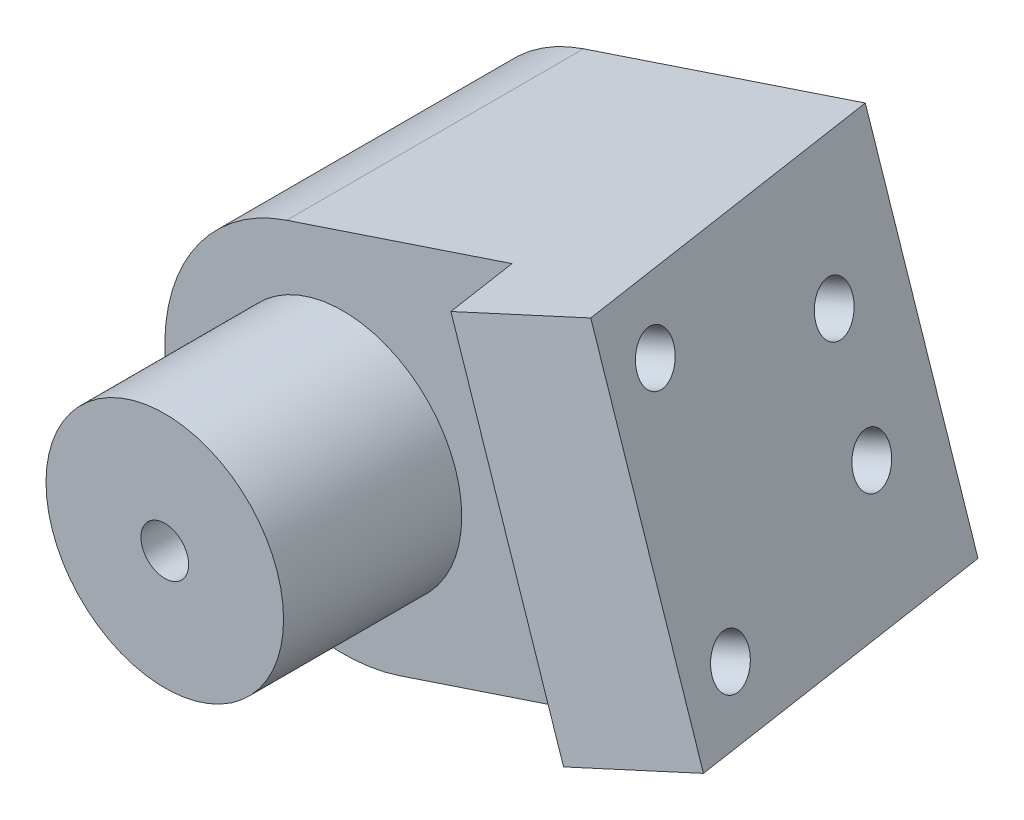
from build123d import *
from build123d.topology import SkipClean

# Parameters (mm, degrees)
BOSS_EXTRUDE1_DEPTH         = 31.75
BOSS_EXTRUDE4_DEPTH         = 38.1
SKETCH11_R                  = 12.7
BOSS_EXTRUDE5_DEPTH         = 19.05
F_1_4_20_TAPPED_HOLE3_D     = 5.1054
F_1_4_20_TAPPED_HOLE3_DEPTH = 38.1
F_1_4_20_TAPPED_HOLE3_TIP   = 1.533816902
F_1_4_20_TAPPED_HOLE4_D     = 5.1054
F_1_4_20_TAPPED_HOLE4_DEPTH = 11.43
F_1_4_20_TAPPED_HOLE4_TIP   = 1.533816902
CUT_EXTRUDE3_DEPTH          = 3.175
SKETCH17_R                  = 15.875
CUT_EXTRUDE4_DEPTH          = 15.875
FILLET3_R                   = 1.5875
CUT_EXTRUDE5_DEPTH          = 6.35
FILLET4_R                   = 1.5875


with BuildPart() as part:
    # Sketch1 → Boss-Extrude1 (new body)
    with BuildSketch(Plane.XY):
        with BuildLine():
            Line((18.072416828, 26.104602085), (30.120694713, -10.040231571))
            Line((30.120694713, -10.040231571), (6.024138943, -18.072416828))
            ThreePointArc((6.024138943, -18.072416828), (-18.072416828, -6.024138943), (-6.024138943, 18.072416828))
            Line((-6.024138943, 18.072416828), (18.072416828, 26.104602085))
        make_face()
    extrude(amount=BOSS_EXTRUDE1_DEPTH)

    # Sketch10 → Boss-Extrude4 (add)
    with BuildSketch(Plane(origin=(-6.024138943, 18.072416828, 0), x_dir=(0.9486832980505138, 0.31622776601683816, 0), z_dir=(-0.31622776601683816, 0.9486832980505138, 0))):
        Polygon((25.4, 0), (31.75, 0), (40.015050599, -37.192726958), (27.240344607, -40.031550568), (25.4, -31.75), align=None)
    extrude(amount=-BOSS_EXTRUDE4_DEPTH)

    # Sketch11 → Boss-Extrude5 (add)
    with BuildSketch(Plane.XY.offset(31.75)):
        with Locations(Location((0, 0, 0), (0, 0, 180))):
            Circle(SKETCH11_R)
    extrude(amount=BOSS_EXTRUDE5_DEPTH)

    # 1/4-20 Tapped Hole3
    with Locations(Plane.XY.offset(50.8)):
        with Locations((0, 0)):
            Hole(F_1_4_20_TAPPED_HOLE3_D / 2, depth=F_1_4_20_TAPPED_HOLE3_DEPTH)
            with Locations((0, 0, -(F_1_4_20_TAPPED_HOLE3_DEPTH + F_1_4_20_TAPPED_HOLE3_TIP / 2))):  # 118° drill point
                Cone(0, F_1_4_20_TAPPED_HOLE3_D / 2, F_1_4_20_TAPPED_HOLE3_TIP, mode=Mode.SUBTRACT)

    # 1/4-20 Tapped Hole4
    with Locations(Plane(origin=(28.703250202, 9.567750067, -6.723529533), x_dir=(-0.2057983060639255, -0.06859943535464187, -0.9761870592720655), z_dir=(0.9260923589044555, 0.30869745296815215, -0.21693046192214882))):
        with Locations((-38.637542166, 12.7), (-16.412542166, 6.35), (-16.412542166, -6.35), (-38.637542166, -12.7)):
            Hole(F_1_4_20_TAPPED_HOLE4_D / 2, depth=F_1_4_20_TAPPED_HOLE4_DEPTH)
            with Locations((0, 0, -(F_1_4_20_TAPPED_HOLE4_DEPTH + F_1_4_20_TAPPED_HOLE4_TIP / 2))):  # 118° drill point
                Cone(0, F_1_4_20_TAPPED_HOLE4_D / 2, F_1_4_20_TAPPED_HOLE4_TIP, mode=Mode.SUBTRACT)

    # Sketch16 → Cut-Extrude3 (cut)
    with BuildSketch(Plane(origin=(0, 0, 0), x_dir=(-1, 0, 0), z_dir=(0, 0, -1))):
        with BuildLine():
            Line((-30.578183366, -6.540991497), (-16.999386581, -3.994967099))
            ThreePointArc((-16.999386581, -3.994967099), (-15.110000404, -8.753673173), (-11.921633961, -12.759841298))
            Line((-11.921633961, -12.759841298), (-30.578183366, -6.540991497))
        make_face()
        with BuildLine():
            Line((-31.84160072, -5.162718019), (-17.29194463, -2.434657503))
            ThreePointArc((-17.29194463, -2.434657503), (-16.566382092, 5.522127364), (-12.372761203, 12.32289278))
            Line((-12.372761203, 12.32289278), (-22.375649764, 23.235134847))
            Line((-22.375649764, 23.235134847), (-31.84160072, -5.162718019))
        make_face()
        with BuildLine():
            Line((-1.88140239, 17.360853415), (-20.537951794, 23.579703217))
            Line((-20.537951794, 23.579703217), (-11.202529005, 13.395605628))
            ThreePointArc((-11.202529005, 13.395605628), (-6.83579642, 16.068938781), (-1.88140239, 17.360853415))
        make_face()
    extrude(amount=-CUT_EXTRUDE3_DEPTH, mode=Mode.SUBTRACT)

    # Sketch17 → Cut-Extrude4 (cut)
    with BuildSketch(Plane(origin=(0, 0, 0), x_dir=(-1, 0, 0), z_dir=(0, 0, -1))):
        Circle(SKETCH17_R)
    extrude(amount=-CUT_EXTRUDE4_DEPTH, mode=Mode.SUBTRACT)

    # Fillet3
    fillet3_edges = [part.edges().sort_by_distance(p)[0] for p in [
        (31.84160072, -5.162718019, 1.5875),
        (22.375649764, 23.235134847, 1.5875),
        (12.372761203, 12.32289278, 1.5875),
        (17.29194463, -2.434657503, 1.5875),
        (11.202529005, 13.395605628, 1.5875),
        (20.537951794, 23.579703217, 1.5875),
        (1.88140239, 17.360853415, 1.5875),
        (16.999386581, -3.994967099, 1.5875),
        (11.921633961, -12.759841298, 1.5875),
        (30.578183366, -6.540991497, 1.5875),
    ]]
    fillet(fillet3_edges, radius=FILLET3_R)

    # Sketch19 → Cut-Extrude5 (cut)
    with SkipClean():  # the faces are left unmerged after this step: merging them gives an invalid solid
        with BuildSketch(Plane(origin=(0, 0, 15.875), x_dir=(-1, 0, 0), z_dir=(0, 0, -1))):
            with BuildLine():
                Line((1.5875, 4.490128061), (1.5875, 15.795425564))
                ThreePointArc((1.5875, 15.795425564), (9.33109088, 12.843144786), (14.531777932, 6.390857152))
                Line((14.531777932, 6.390857152), (3.779801072, 2.897328097))
                ThreePointArc((3.779801072, 2.897328097), (2.799327264, 3.852943436), (1.5875, 4.490128061))
            make_face()
            with BuildLine():
                Line((-1.5875, 4.490128061), (-1.5875, 15.795425564))
                ThreePointArc((-1.5875, 15.795425564), (-9.33109088, 12.843144786), (-14.531777932, 6.390857152))
                Line((-14.531777932, 6.390857152), (-3.779801072, 2.897328097))
                ThreePointArc((-3.779801072, 2.897328097), (-2.799327264, 3.852943436), (-1.5875, 4.490128061))
            make_face()
            with BuildLine():
                Line((4.76093003, -0.122276342), (15.512906889, 3.371252713))
                ThreePointArc((15.512906889, 3.371252713), (15.098022196, -4.905644786), (10.568632679, -11.845658627))
                Line((10.568632679, -11.845658627), (3.923545533, -2.69948082))
                ThreePointArc((3.923545533, -2.69948082), (4.529406659, -1.471693436), (4.76093003, -0.122276342))
            make_face()
            with BuildLine():
                Line((1.354916576, -4.565698996), (8.000003722, -13.711876803))
                ThreePointArc((8.000003722, -13.711876803), (0, -15.875), (-8.000003722, -13.711876803))
                Line((-8.000003722, -13.711876803), (-1.354916576, -4.565698996))
                ThreePointArc((-1.354916576, -4.565698996), (0, -4.7625), (1.354916576, -4.565698996))
            make_face()
            with BuildLine():
                Line((-3.923545533, -2.69948082), (-10.568632679, -11.845658627))
                ThreePointArc((-10.568632679, -11.845658627), (-15.098022196, -4.905644786), (-15.512906889, 3.371252713))
                Line((-15.512906889, 3.371252713), (-4.76093003, -0.122276342))
                ThreePointArc((-4.76093003, -0.122276342), (-4.529406659, -1.471693436), (-3.923545533, -2.69948082))
            make_face()
        extrude(amount=-CUT_EXTRUDE5_DEPTH, mode=Mode.SUBTRACT)

    # Fillet4
    # the kernel refuses this fillet: 1.5875 mm, written as the material it adds along each edge
    with BuildSketch(Plane(origin=(-3.779801072, 2.897328097, 15.875), x_dir=(0.678616300980504, 0.7344929652784552, 0), z_dir=(0, 0, 1)), Plane(origin=(1.5875, 4.490128061, 15.875), x_dir=(0.9082482904638647, -0.4184316465917308, 0), z_dir=(0, 0, 1)), Plane(origin=(1.354916576, -4.565698996, 15.875), x_dir=(-0.9807362530563359, -0.1953366374775062, 0), z_dir=(0, 0, 1)), Plane(origin=(4.76093003, -0.122276342, 15.875), x_dir=(-0.1172879872498498, -0.9930979448407287, 0), z_dir=(0, 0, 1))) as fillet4_piece_1:
        with BuildLine():
            CenterArc((1.019590872, 1.580803791), FILLET4_R, 204.735610317, 60)
            Line((-0.422253289, 0.916543552), (0, 0))
            ThreePointArc((0, 0), (0.436967517, 0.020088626), (0.873935033, 0))
        make_face()
    extrude(amount=8.872833134)
    with BuildSketch(Plane(origin=(-1.5875, 4.490128061, 15.875), x_dir=(0, 1, 0), z_dir=(0, 0, 1)), Plane(origin=(3.779801072, 2.897328097, 15.875), x_dir=(0.9510565162951539, 0.30901699437494645, 0), z_dir=(0, 0, 1)), Plane(origin=(-4.76093003, -0.122276342, 15.875), x_dir=(-0.9510565162951536, 0.3090169943749475, 0), z_dir=(0, 0, 1)), Plane(origin=(-1.354916576, -4.565698996, 15.875), x_dir=(-0.5877852522924731, -0.8090169943749473, 0), z_dir=(0, 0, 1)), Plane(origin=(3.923545533, -2.69948082, 15.875), x_dir=(0.5877852522924732, -0.8090169943749472, 0), z_dir=(0, 0, 1))) as fillet4_piece_2:
        with BuildLine():
            CenterArc((1.009133253, 1.5875), FILLET4_R, 210, 60)
            ThreePointArc((-0.365682075, 0.79375), (-0.164595577, 0.405280717), (0, 0))
            Line((0, 0), (1.009133253, 0))
        make_face()
    extrude(amount=8.872833134)
    with BuildSketch(Plane(origin=(-1.5875, 15.795425564, 15.875), x_dir=(-0.9868856549354627, -0.16142089109716581, 0), z_dir=(0, 0, 1)), Plane(origin=(14.531777932, 6.390857152, 15.875), x_dir=(-0.4584848292240369, 0.8887022343684108, 0), z_dir=(0, 0, 1)), Plane(origin=(-15.512906889, 3.371252713, 15.875), x_dir=(-0.15144404853577972, -0.9884658315607537, 0), z_dir=(0, 0, 1)), Plane(origin=(-8.000003722, -13.711876803, 15.875), x_dir=(0.8932880855464623, -0.4494845895253098, 0), z_dir=(0, 0, 1)), Plane(origin=(10.568632679, -11.845658627, 15.875), x_dir=(0.7035264471488165, 0.7106690778148178, 0), z_dir=(0, 0, 1))) as fillet4_piece_3:
        with BuildLine():
            CenterArc((1.867758316, 1.584453457), FILLET4_R, 170.710620558, 102.839588407)
            Line((0.301077339, 1.840709121), (0, 0))
            ThreePointArc((0, 0), (0.983030693, -0.030465433), (1.966061385, 0))
        make_face()
    extrude(amount=11.265153463)
    with BuildSketch(Plane(origin=(-14.531777932, 6.390857152, 15.875), x_dir=(0.45848482922403855, 0.88870223436841, 0), z_dir=(0, 0, 1)), Plane(origin=(1.5875, 15.795425564, 15.875), x_dir=(0.9868856549354627, -0.16142089109716573, 0), z_dir=(0, 0, 1)), Plane(origin=(-10.568632679, -11.845658627, 15.875), x_dir=(-0.7035264471488155, 0.7106690778148187, 0), z_dir=(0, 0, 1)), Plane(origin=(8.000003722, -13.711876803, 15.875), x_dir=(-0.8932880855464624, -0.4494845895253094, 0), z_dir=(0, 0, 1)), Plane(origin=(15.512906889, 3.371252713, 15.875), x_dir=(0.1514440485357779, -0.988465831560754, 0), z_dir=(0, 0, 1))) as fillet4_piece_4:
        with BuildLine():
            CenterArc((1.867758316, -1.584453457), FILLET4_R, 86.449791035, 102.839588407)
            Line((0.301077339, -1.840709121), (0, 0))
            ThreePointArc((0, 0), (0.983030693, 0.030465433), (1.966061385, 0))
        make_face()
    extrude(amount=11.265153463)
    with BuildSketch(Plane(origin=(-3.923545533, -2.69948082, 15.875), x_dir=(-0.5877852522924727, -0.8090169943749477, 0), z_dir=(0, 0, 1))) as fillet4_piece_5:
        with BuildLine():
            CenterArc((1.009133253, -1.5875), FILLET4_R, 90, 60)
            ThreePointArc((-0.365682075, -0.79375), (-0.164595577, -0.405280717), (0, 0))
            Line((0, 0), (1.009133253, 0))
        make_face()
    extrude(amount=8.872833134)


solid = part.part
